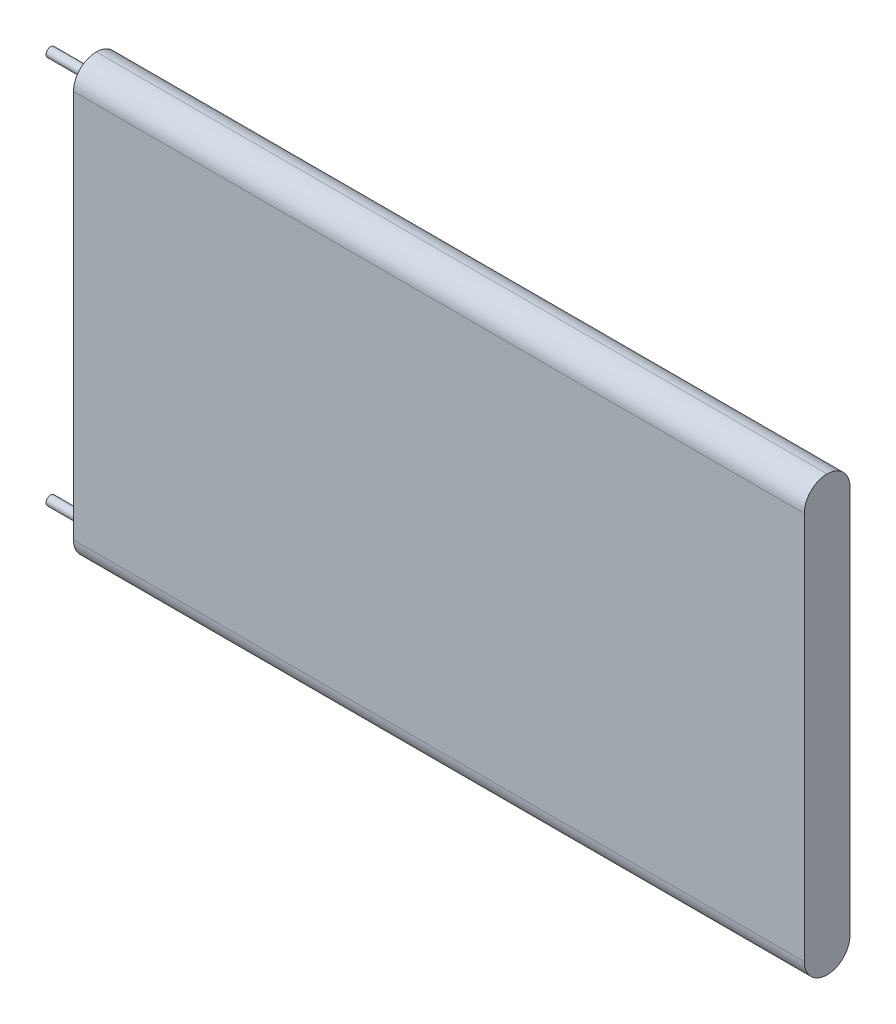
from build123d import *

# Parameters (mm, degrees)
SKETCH1_W           = 101.6
SKETCH1_H           = 60.325
BOSS_EXTRUDE1_DEPTH = 6.35
FILLET1_R           = 3.175
SKETCH2_R           = 0.635
BOSS_EXTRUDE2_DEPTH = 6.35


with BuildPart() as part:
    # Sketch1 → Boss-Extrude1 (new body)
    with BuildSketch(Plane.XY):
        Rectangle(SKETCH1_W, SKETCH1_H)
    extrude(amount=BOSS_EXTRUDE1_DEPTH)

    # Fillet1
    fillet1_edges = [part.edges().sort_by_distance(p)[0] for p in [
        (0, 30.1625, 6.35),
        (0, 30.1625, 0),
        (0, -30.1625, 6.35),
        (0, -30.1625, 0),
    ]]
    fillet(fillet1_edges, radius=FILLET1_R - 0.0001)  # a hair under: the kernel refuses the full size

    # Sketch2 → Boss-Extrude2 (add)
    with BuildSketch(Plane.ZY.offset(50.8)):
        with Locations(Location((3.175, 26.9875, 0), (0, 0, 180))):
            Circle(SKETCH2_R)
        with Locations(Location((3.175, -26.9875, 0), (0, 0, 180))):
            Circle(SKETCH2_R)
    extrude(amount=BOSS_EXTRUDE2_DEPTH)


solid = part.part
